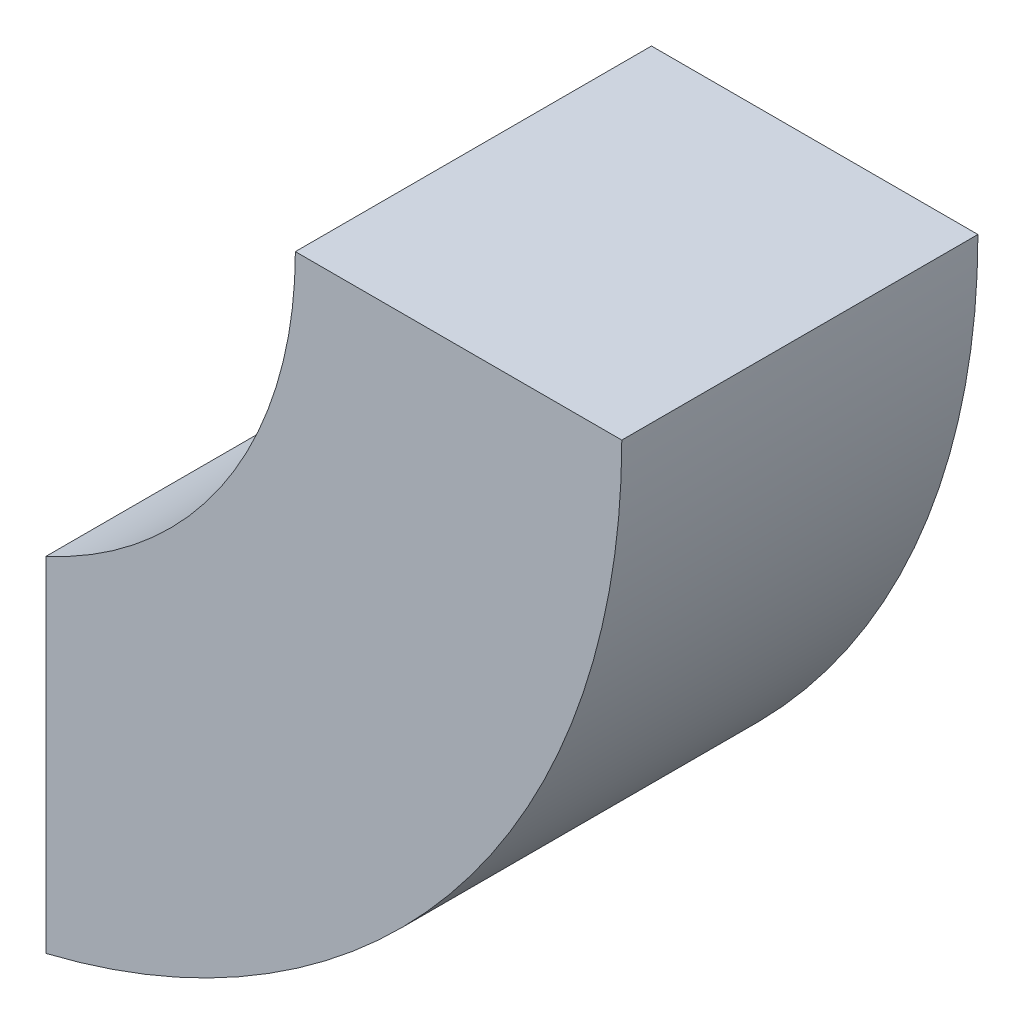
from build123d import *

# Parameters (mm, degrees)
BOSS_EXTRUDE1_DEPTH = 30


with BuildPart() as part:
    # Sketch1 → Boss-Extrude1 (new body)
    with BuildSketch(Plane.XY):
        with BuildLine():
            Line((36, 0), (63.5, 0))
            ThreePointArc((63.5, 0), (49.923691771, -39.241241061), (15, -61.702917273))
            Line((15, -61.702917273), (15, -32.726136344))
            ThreePointArc((15, -32.726136344), (30.298514815, -19.442222095), (36, 0))
        make_face()
    extrude(amount=BOSS_EXTRUDE1_DEPTH)


solid = part.part
